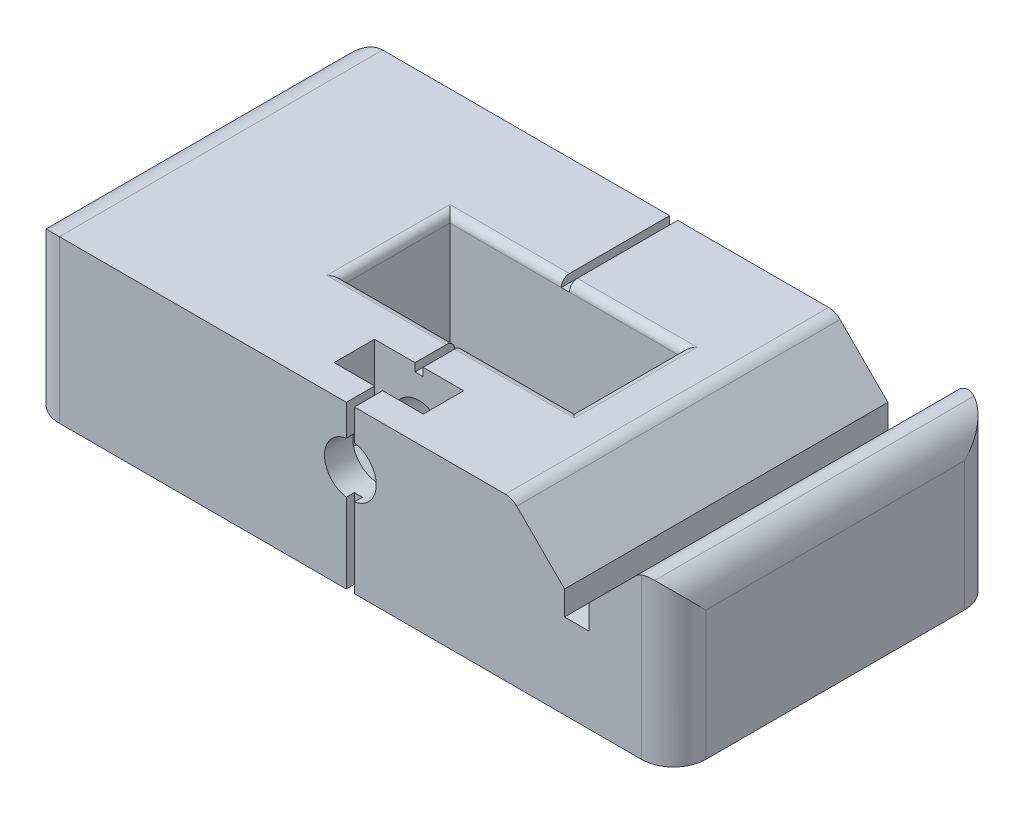
from build123d import *

# Parameters (mm, degrees)
SKETCH1_W           = 40
SKETCH1_H           = 20
BOSS_EXTRUDE1_DEPTH = 10
SKETCH2_R           = 5.15
CUT_EXTRUDE1_DEPTH  = 2.4
CUT_EXTRUDE2_DEPTH  = 31
FILLET1_R           = 2
SKETCH4_W           = 0.5
SKETCH4_H           = 10
CUT_EXTRUDE3_DEPTH  = 0.5
SKETCH5_W           = 0.5
SKETCH5_H           = 20
CUT_EXTRUDE4_DEPTH  = 0.5
SKETCH6_W           = 0.5
SKETCH6_H           = 10
CUT_EXTRUDE5_DEPTH  = 0.5
FILLET2_R           = 1
SKETCH8_W           = 14.3
SKETCH8_H           = 7
CUT_EXTRUDE7_DEPTH  = 3.3
SKETCH9_R           = 1.6
CUT_EXTRUDE8_DEPTH  = 10
CUT_EXTRUDE9_DEPTH  = 1.25
FILLET4_R           = 0.5


# Some blends are built 0.0001 mm under size
with BuildPart() as part:
    # Sketch1 → Boss-Extrude1 (new body)
    with BuildSketch(Plane(origin=(0, 0, 0), x_dir=(1, 0, 0), z_dir=(0, 1, 0))):
        Rectangle(SKETCH1_W, SKETCH1_H)
    extrude(amount=BOSS_EXTRUDE1_DEPTH)

    # Sketch2 → Cut-Extrude1 (cut)
    with BuildSketch(Plane.XZ):
        with Locations(Location((0, 0, 0), (0, 0, 270))):
            Circle(SKETCH2_R)
        with Locations(Location((12, 0, 0), (0, 0, 270))):
            Circle(SKETCH2_R)
        with Locations(Location((-12, 0, 0), (0, 0, 270))):
            Circle(SKETCH2_R)
    extrude(amount=-CUT_EXTRUDE1_DEPTH, mode=Mode.SUBTRACT)

    # Sketch3 → Cut-Extrude2 (cut, through all)
    with BuildSketch(Plane.XY.offset(10)):
        Polygon((18, 10), (14.75, 6.75), (14.75, 5.25), (13.25, 5.25), (13.25, 6.75), (10, 10), align=None)
    extrude(amount=-CUT_EXTRUDE2_DEPTH, mode=Mode.SUBTRACT)

    # Fillet1
    fillet1_edges = [part.edges().sort_by_distance(p)[0] for p in [
        (20, 10, 0),
        (-20, 10, 0),
        (-20, 5, -10),
        (20, 5, -10),
        (20, 5, 10),
        (-20, 5, 10),
    ]]
    fillet(fillet1_edges, radius=FILLET1_R - 0.0001)  # a hair under: the kernel refuses the full size

    # Sketch4 → Cut-Extrude3 (cut)
    with BuildSketch(Plane.XY.offset(10)):
        with Locations((0, 5)):
            Rectangle(SKETCH4_W, SKETCH4_H)
    extrude(amount=-CUT_EXTRUDE3_DEPTH, mode=Mode.SUBTRACT)

    # Sketch5 → Cut-Extrude4 (cut)
    with BuildSketch(Plane(origin=(0, 10, 0), x_dir=(1, 0, 0), z_dir=(0, 1, 0))):
        Rectangle(SKETCH5_W, SKETCH5_H)
    extrude(amount=-CUT_EXTRUDE4_DEPTH, mode=Mode.SUBTRACT)

    # Sketch6 → Cut-Extrude5 (cut)
    with BuildSketch(Plane(origin=(0, 0, -10), x_dir=(-1, 0, 0), z_dir=(0, 0, -1))):
        with Locations((0, 5)):
            Rectangle(SKETCH6_W, SKETCH6_H)
    extrude(amount=-CUT_EXTRUDE5_DEPTH, mode=Mode.SUBTRACT)

    # Fillet2
    # the kernel refuses this fillet: 1 mm, written as the material it takes off along each edge
    with BuildSketch(Plane(origin=(10, 10, 11.035533906), x_dir=(0.7071067811865476, -0.7071067811865476, 0), z_dir=(0, 0, -1))) as fillet2_piece_1:
        with BuildLine():
            CenterArc((FILLET2_R * 0.414213562373, FILLET2_R), FILLET2_R, 225, 45)
            Line((-FILLET2_R * 0.292893218813, FILLET2_R * 0.292893218813), (0, 0))
            Line((0, 0), (FILLET2_R * 0.414213562373, 0))
        make_face()
    extrude(amount=22.071067812, mode=Mode.SUBTRACT)
    with BuildSketch(Plane(origin=(18, 10, 11.781961717), x_dir=(-0.7071067811865406, -0.7071067811865547, 0), z_dir=(0, 0, -1))) as fillet2_piece_2:
        with BuildLine():
            CenterArc((0.504002289, -1), FILLET2_R, 90, 65.527591719)
            Line((-0.406158578, -0.585745012), (-0.497174665, -0.544319513))
            ThreePointArc((-0.497174665, -0.544319513), (-0.070781389, 0.070639967), (-0.070710678, 0.070710678))
            Line((-0.070710678, 0.070710678), (0, 0.1))
            Line((0, 0.1), (0.504002289, 0.1))
            Line((0.504002289, 0.1), (0.504002289, 0))
        make_face()
    extrude(amount=23.563923435, mode=Mode.SUBTRACT)

    # Sketch8 → Cut-Extrude7 (cut, symmetric)
    with BuildSketch(Plane.XY):
        with Locations((0, 6.5)):
            Rectangle(SKETCH8_W, SKETCH8_H)
    extrude(amount=CUT_EXTRUDE7_DEPTH, both=True, mode=Mode.SUBTRACT)

    # Sketch9 → Cut-Extrude8 (cut)
    with BuildSketch(Plane.XY.offset(10)):
        with Locations((0, 6.5)):
            Circle(SKETCH9_R)
    extrude(amount=-CUT_EXTRUDE8_DEPTH, mode=Mode.SUBTRACT)

    # Sketch10 → Cut-Extrude9 (cut, symmetric)
    with BuildSketch(Plane.XY.offset(7)):
        Polygon((-2.76, 8.093486743), (-2.76, 10), (2.76, 10), (2.76, 8.081939738), (2.76, 4.906513257), (0, 3.313026514), (-2.76, 4.906513257), align=None)
    extrude(amount=CUT_EXTRUDE9_DEPTH, both=True, mode=Mode.SUBTRACT)

    # Fillet4
    fillet4_edges = [part.edges().sort_by_distance(p)[0] for p in [
        (3.7, 10, -3.3),
        (7.15, 10, 0),
        (3.7, 10, 3.3),
        (-3.7, 10, 3.3),
        (-7.15, 10, 0),
        (-3.7, 10, -3.3),
    ]]
    fillet(fillet4_edges, radius=FILLET4_R)


solid = part.part
